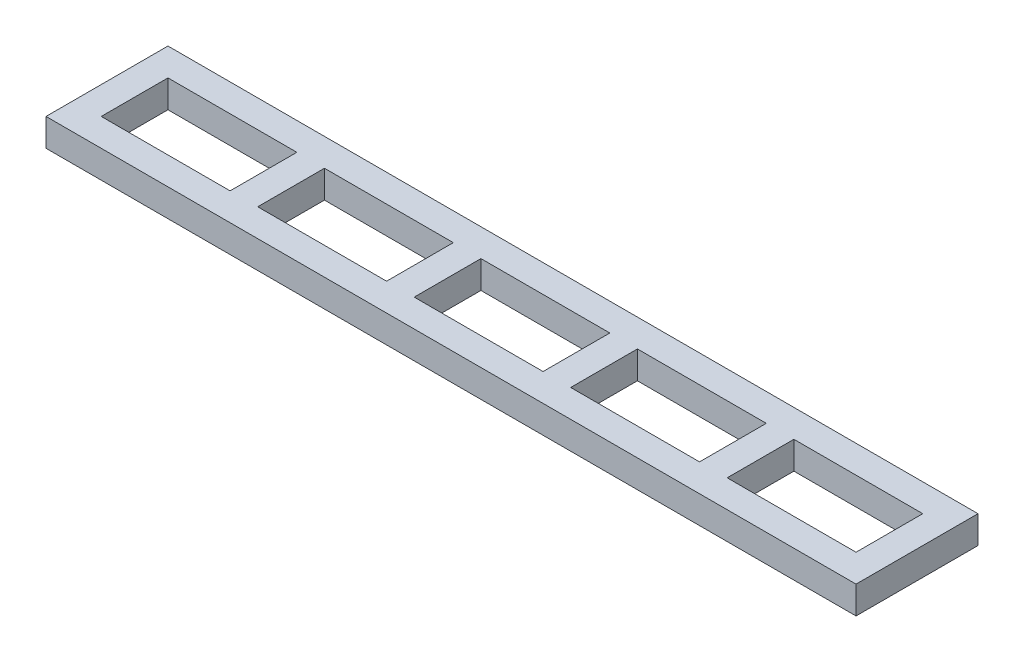
from build123d import *

# Parameters (mm, degrees)
SKETCH1_W           = 84.1375
SKETCH1_H           = 19.05
BOSS_EXTRUDE1_DEPTH = 279.4
SKETCH2_W           = 88.9
SKETCH2_H           = 46.0375
CUT_EXTRUDE1_DEPTH  = 284.190822991


with BuildPart() as part:
    # Sketch1 → Boss-Extrude1 (new, symmetric)
    with BuildSketch(Plane(origin=(0, 0, 0), x_dir=(0, 0, -1), z_dir=(1, 0, 0))):
        Rectangle(SKETCH1_W, SKETCH1_H)
    extrude(amount=BOSS_EXTRUDE1_DEPTH, both=True)

    # Sketch2 → Cut-Extrude1 (cut, through all)
    with BuildSketch(Plane(origin=(0, 9.525, 0), x_dir=(1, 0, 0), z_dir=(0, 1, 0))):
        with Locations((-215.9, 0)):
            Rectangle(SKETCH2_W, SKETCH2_H)
        with Locations((215.9, 0)):
            Rectangle(SKETCH2_W, SKETCH2_H)
        with Locations((-107.95, 0)):
            Rectangle(SKETCH2_W, SKETCH2_H)
        Rectangle(SKETCH2_W, SKETCH2_H)
        with Locations((107.95, 0)):
            Rectangle(SKETCH2_W, SKETCH2_H)
    extrude(amount=-CUT_EXTRUDE1_DEPTH, mode=Mode.SUBTRACT)


solid = part.part
